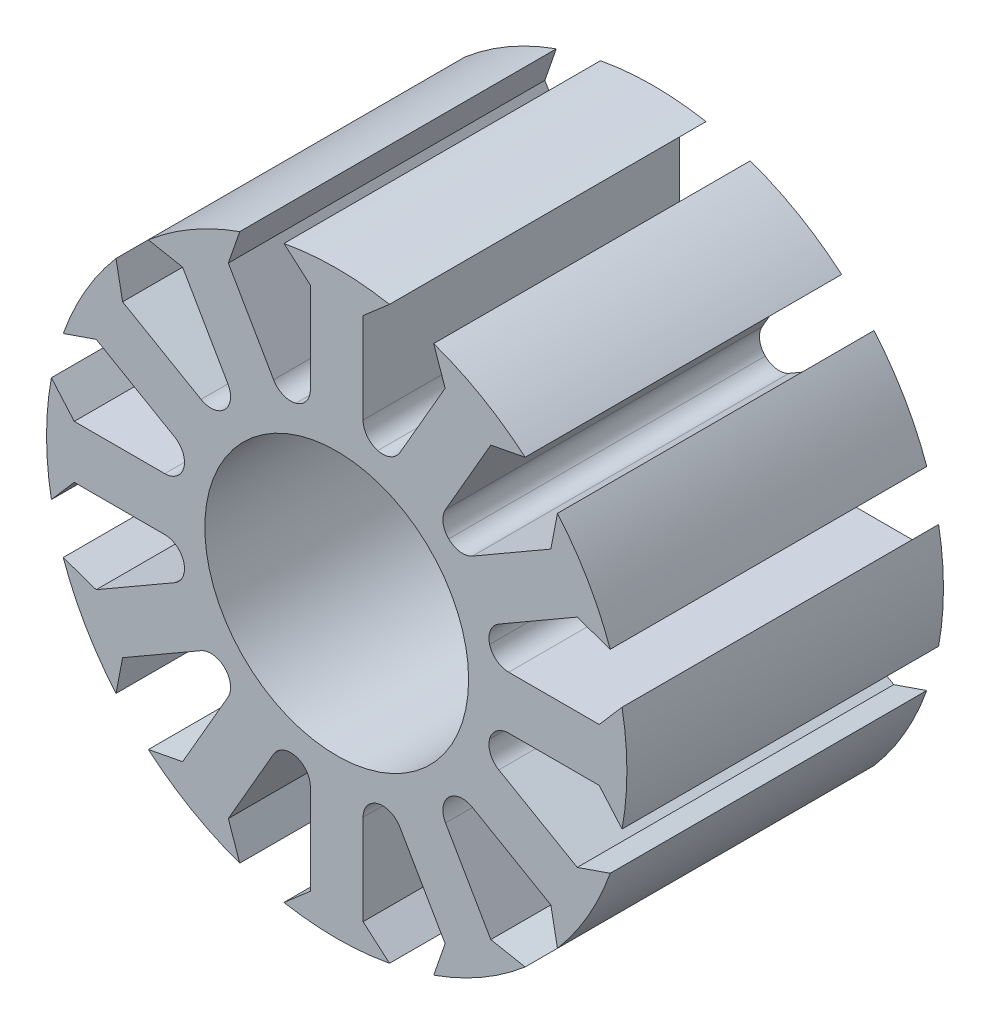
from build123d import *

# Parameters (mm, degrees)
BOSS_EXTRUDE1_DEPTH = 12
SKETCH2_R           = 6
BOSS_EXTRUDE2_DEPTH = 12
SKETCH3_R           = 5
CUT_EXTRUDE1_DEPTH  = 12
FILLET1_R           = 0.75
FILLET2_R           = 0.75
FILLET3_R           = 0.75
FILLET4_R           = 0.75


with BuildPart() as part:
    # Sketch1 → Boss-Extrude1 (new body)
    with BuildSketch(Plane.XY):
        with BuildLine():
            Line((-1, 9.949874371), (-2, 10.816653826))
            ThreePointArc((-2, 10.816653826), (0, 11), (2, 10.816653826))
            Line((2, 10.816653826), (1, 9.949874371))
            Line((1, 9.949874371), (1, 4.898979486))
            ThreePointArc((1, 4.898979486), (1.294095226, 4.829629131), (1.583464339, 4.742640687))
            Line((1.583464339, 4.742640687), (4.108911782, 9.11684397))
            Line((4.108911782, 9.11684397), (3.676276106, 10.367496998))
            ThreePointArc((3.676276106, 10.367496998), (5.5, 9.526279442), (7.140377721, 8.367496998))
            Line((7.140377721, 8.367496998), (5.840962589, 8.11684397))
            Line((5.840962589, 8.11684397), (3.315515147, 3.742640687))
            ThreePointArc((3.315515147, 3.742640687), (3.535533906, 3.535533906), (3.742640687, 3.315515147))
            Line((3.742640687, 3.315515147), (8.11684397, 5.840962589))
            Line((8.11684397, 5.840962589), (8.367496998, 7.140377721))
            ThreePointArc((8.367496998, 7.140377721), (9.526279442, 5.5), (10.367496998, 3.676276106))
            Line((10.367496998, 3.676276106), (9.11684397, 4.108911782))
            Line((9.11684397, 4.108911782), (4.742640687, 1.583464339))
            ThreePointArc((4.742640687, 1.583464339), (4.829629131, 1.294095226), (4.898979486, 1))
            Line((4.898979486, 1), (9.949874371, 1))
            Line((9.949874371, 1), (10.816653826, 2))
            ThreePointArc((10.816653826, 2), (11, 0), (10.816653826, -2))
            Line((10.816653826, -2), (9.949874371, -1))
            Line((9.949874371, -1), (4.898979486, -1))
            ThreePointArc((4.898979486, -1), (4.829629131, -1.294095226), (4.742640687, -1.583464339))
            Line((4.742640687, -1.583464339), (9.11684397, -4.108911782))
            Line((9.11684397, -4.108911782), (10.367496998, -3.676276106))
            ThreePointArc((10.367496998, -3.676276106), (9.526279442, -5.5), (8.367496998, -7.140377721))
            Line((8.367496998, -7.140377721), (8.11684397, -5.840962589))
            Line((8.11684397, -5.840962589), (3.742640687, -3.315515147))
            ThreePointArc((3.742640687, -3.315515147), (3.535533906, -3.535533906), (3.315515147, -3.742640687))
            Line((3.315515147, -3.742640687), (5.840962589, -8.11684397))
            Line((5.840962589, -8.11684397), (7.140377721, -8.367496998))
            ThreePointArc((7.140377721, -8.367496998), (5.5, -9.526279442), (3.676276106, -10.367496998))
            Line((3.676276106, -10.367496998), (4.108911782, -9.11684397))
            Line((4.108911782, -9.11684397), (1.583464339, -4.742640687))
            ThreePointArc((1.583464339, -4.742640687), (1.294095226, -4.829629131), (1, -4.898979486))
            Line((1, -4.898979486), (1, -9.949874371))
            Line((1, -9.949874371), (2, -10.816653826))
            ThreePointArc((2, -10.816653826), (0, -11), (-2, -10.816653826))
            Line((-2, -10.816653826), (-1, -9.949874371))
            Line((-1, -9.949874371), (-1, -4.898979486))
            ThreePointArc((-1, -4.898979486), (-1.294095226, -4.829629131), (-1.583464339, -4.742640687))
            Line((-1.583464339, -4.742640687), (-4.108911782, -9.11684397))
            Line((-4.108911782, -9.11684397), (-3.676276106, -10.367496998))
            ThreePointArc((-3.676276106, -10.367496998), (-5.5, -9.526279442), (-7.140377721, -8.367496998))
            Line((-7.140377721, -8.367496998), (-5.840962589, -8.11684397))
            Line((-5.840962589, -8.11684397), (-3.315515147, -3.742640687))
            ThreePointArc((-3.315515147, -3.742640687), (-3.535533906, -3.535533906), (-3.742640687, -3.315515147))
            Line((-3.742640687, -3.315515147), (-8.11684397, -5.840962589))
            Line((-8.11684397, -5.840962589), (-8.367496998, -7.140377721))
            ThreePointArc((-8.367496998, -7.140377721), (-9.526279442, -5.5), (-10.367496998, -3.676276106))
            Line((-10.367496998, -3.676276106), (-9.11684397, -4.108911782))
            Line((-9.11684397, -4.108911782), (-4.742640687, -1.583464339))
            ThreePointArc((-4.742640687, -1.583464339), (-4.829629131, -1.294095226), (-4.898979486, -1))
            Line((-4.898979486, -1), (-9.949874371, -1))
            Line((-9.949874371, -1), (-10.816653826, -2))
            ThreePointArc((-10.816653826, -2), (-11, 0), (-10.816653826, 2))
            Line((-10.816653826, 2), (-9.949874371, 1))
            Line((-9.949874371, 1), (-4.898979486, 1))
            ThreePointArc((-4.898979486, 1), (-4.829629131, 1.294095226), (-4.742640687, 1.583464339))
            Line((-4.742640687, 1.583464339), (-9.11684397, 4.108911782))
            Line((-9.11684397, 4.108911782), (-10.367496998, 3.676276106))
            ThreePointArc((-10.367496998, 3.676276106), (-9.526279442, 5.5), (-8.367496998, 7.140377721))
            Line((-8.367496998, 7.140377721), (-8.11684397, 5.840962589))
            Line((-8.11684397, 5.840962589), (-3.742640687, 3.315515147))
            ThreePointArc((-3.742640687, 3.315515147), (-3.535533906, 3.535533906), (-3.315515147, 3.742640687))
            Line((-3.315515147, 3.742640687), (-5.840962589, 8.11684397))
            Line((-5.840962589, 8.11684397), (-7.140377721, 8.367496998))
            ThreePointArc((-7.140377721, 8.367496998), (-5.5, 9.526279442), (-3.676276106, 10.367496998))
            Line((-3.676276106, 10.367496998), (-4.108911782, 9.11684397))
            Line((-4.108911782, 9.11684397), (-1.583464339, 4.742640687))
            ThreePointArc((-1.583464339, 4.742640687), (-1.294095226, 4.829629131), (-1, 4.898979486))
            Line((-1, 4.898979486), (-1, 9.949874371))
        make_face()
    extrude(amount=BOSS_EXTRUDE1_DEPTH)

    # Sketch2 → Boss-Extrude2 (add)
    with BuildSketch(Plane.XY.offset(12)):
        Circle(SKETCH2_R)
    extrude(amount=-BOSS_EXTRUDE2_DEPTH)

    # Sketch3 → Cut-Extrude1 (cut)
    with BuildSketch(Plane.XY.offset(12)):
        Circle(SKETCH3_R)
    extrude(amount=-CUT_EXTRUDE1_DEPTH, mode=Mode.SUBTRACT)

    # Fillet1
    fillet1_edges = [part.edges().sort_by_distance(p)[0] for p in [
        (-4.623475383, 3.824065295, 6),
    ]]
    fillet(fillet1_edges, radius=FILLET1_R)

    # Fillet2
    # the kernel refuses this fillet: 0.75 mm, written as the material it adds along each edge
    with BuildSketch(Plane(origin=(-3.824065295, 4.623475383, 0), x_dir=(-0.7395125518358552, -0.6731427676780178, 0), z_dir=(0, 0, 1))) as fillet2_piece_1:
        with BuildLine():
            CenterArc((0.604168803, -0.749157497), FILLET2_R, 92.716022766, 74.973886241)
            Line((-0.128587227, -0.589255651), (0, 0))
            ThreePointArc((0, 0), (0.284314731, -0.006740024), (0.568629461, 0))
        make_face()
    extrude(amount=12)

    # Fillet3
    fillet3_edges = [part.edges().sort_by_distance(p)[0] for p in [
        (3.824065295, 4.623475383, 6),
        (1, 5.916079783, 6),
        (-2.092014488, 5.623475383, 6),
        (-5.916079783, 1, 6),
        (-5.623475383, -2.092014488, 6),
        (-3.824065295, -4.623475383, 6),
        (-1, -5.916079783, 6),
        (2.092014488, -5.623475383, 6),
        (4.623475383, -3.824065295, 6),
        (5.916079783, -1, 6),
        (5.623475383, 2.092014488, 6),
    ]]
    fillet(fillet3_edges, radius=FILLET3_R)

    # Fillet4
    # the kernel refuses this fillet: 0.75 mm, written as the material it adds along each edge
    with BuildSketch(Plane(origin=(-5.916079783, -1, 0), x_dir=(-1, 0, 0), z_dir=(0, 0, 1)), Plane(origin=(-4.623475383, -3.824065295, 0), x_dir=(-0.8660254037844433, -0.4999999999999918, 0), z_dir=(0, 0, 1)), Plane(origin=(-2.092014488, -5.623475383, 0), x_dir=(-0.5000000000000068, -0.8660254037844348, 0), z_dir=(0, 0, 1)), Plane(origin=(1, -5.916079783, 0), x_dir=(0, -1, 0), z_dir=(0, 0, 1)), Plane(origin=(-5.623475383, 2.092014488, 0), x_dir=(-0.8660254037844328, 0.5000000000000101, 0), z_dir=(0, 0, 1))) as fillet4_piece_1:
        with BuildLine():
            CenterArc((0.603099347, 0.75), FILLET4_R, 195.444398539, 74.555601461)
            Line((-0.119817654, 0.550272663), (-0.134275994, 0.546278116))
            ThreePointArc((-0.134275994, 0.546278116), (-0.068105699, 0.273351526), (-0.014790199, -0.0025))
            Line((-0.014790199, -0.0025), (0, -0.015))
            Line((0, -0.015), (0.603099347, -0.015))
            Line((0.603099347, -0.015), (0.603099347, 0))
        make_face()
    extrude(amount=12)
    with BuildSketch(Plane(origin=(3.824065295, -4.623475383, 0), x_dir=(0.7398192740207736, 0.6728056493426431, 0), z_dir=(0, 0, 1)), Plane(origin=(5.623475383, -2.092014488, 0), x_dir=(0.30429946084002696, 0.9525764211508013, 0), z_dir=(0, 0, 1)), Plane(origin=(5.916079783, 1, 0), x_dir=(-0.21275714713002825, 0.9771051101826719, 0), z_dir=(0, 0, 1)), Plane(origin=(4.623475383, 3.824065295, 0), x_dir=(-0.6728056493426434, 0.7398192740207732, 0), z_dir=(0, 0, 1)), Plane(origin=(2.092014488, 5.623475383, 0), x_dir=(-0.9525764211508011, 0.30429946084002774, 0), z_dir=(0, 0, 1)), Plane(origin=(-1, 5.916079783, 0), x_dir=(-0.9771051101826725, -0.21275714713002564, 0), z_dir=(0, 0, 1))) as fillet4_piece_2:
        with BuildLine():
            CenterArc((0.604515136, -0.748859315), FILLET4_R, 93.160421305, 74.555601461)
            Line((-0.128313697, -0.589291454), (-0.142970273, -0.586100097))
            Line((-0.142970273, -0.586100097), (-0.014656577, 0.003191357))
            Line((-0.014656577, 0.003191357), (0.000703958, 0.014983472))
            ThreePointArc((0.000703958, 0.014983472), (0.281583147, 0.008388935), (0.562339316, 0.014977186))
            Line((0.562339316, 0.014977186), (0.563166293, 0))
        make_face()
    extrude(amount=12)


solid = part.part
